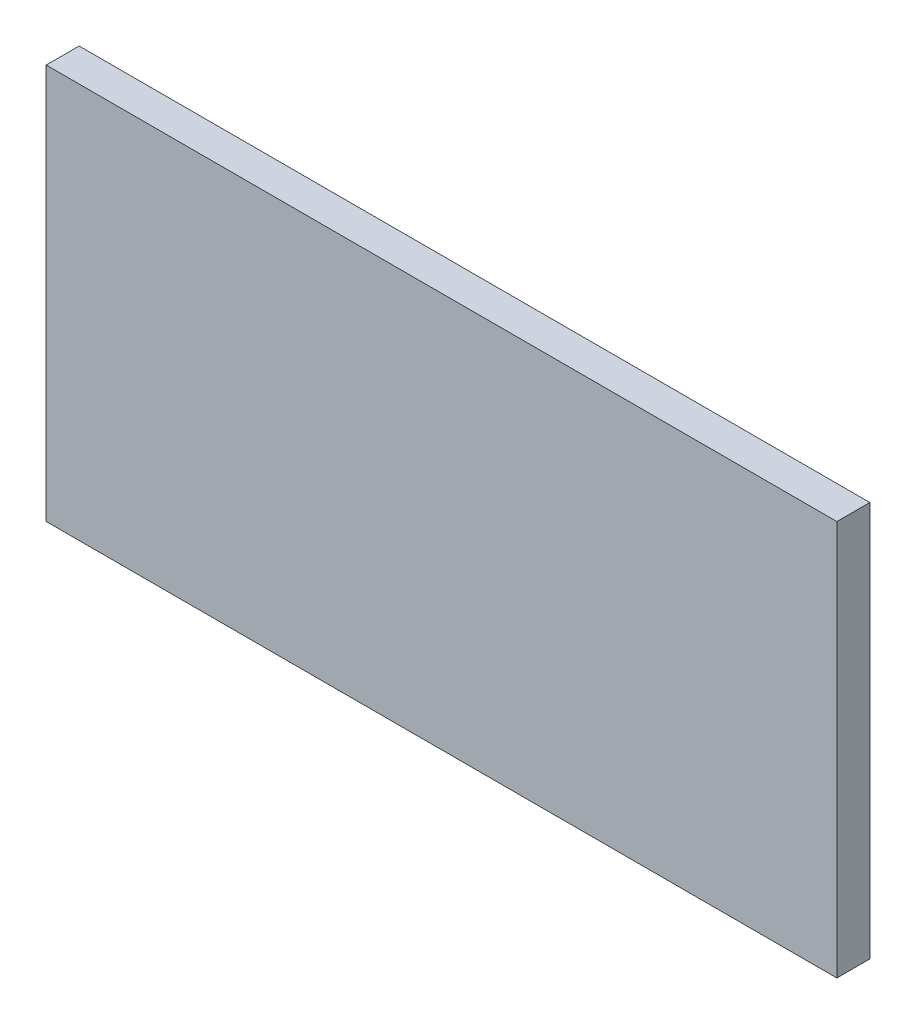
from build123d import *

# Parameters (mm, degrees)
SKETCH1_W           = 152.4
SKETCH1_H           = 76.2
BOSS_EXTRUDE1_DEPTH = 6.35


with BuildPart() as part:
    # Sketch1 → Boss-Extrude1 (new body)
    with BuildSketch(Plane.XY):
        with Locations((76.2, -38.1)):
            Rectangle(SKETCH1_W, SKETCH1_H)
    extrude(amount=BOSS_EXTRUDE1_DEPTH)


solid = part.part
